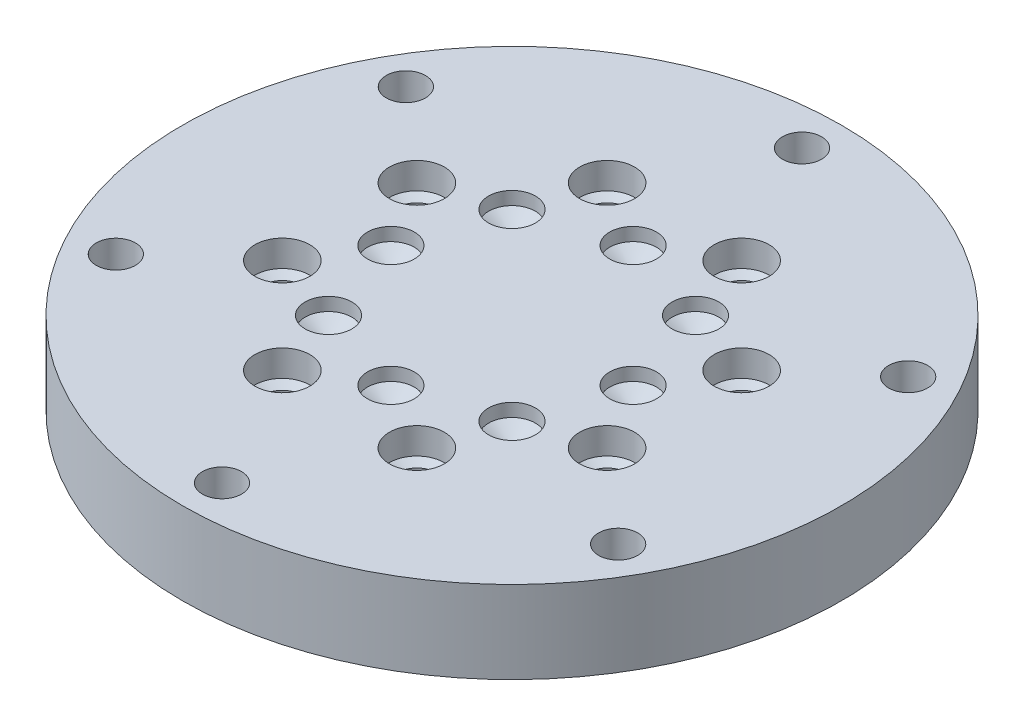
from build123d import *

# Parameters (mm, degrees)
OUTER_R                               = 19.05
BODY_DEPTH                            = 4.7625
F_4_40_TAPPED_HOLE_D                  = 2.2606
SCREW_HOLES_COUNT                     = 6
F_43_0_089_DIAMETER_HOLE1_D           = 2.2606
IO_HOLES_PATTERN_COUNT                = 8
F_36_0_1065_DIAMETER_HOLE1_AT_2_COUNT = 2
F_36_0_1065_DIAMETER_HOLE1_AT_2_PITCH = 5.568104507
POST_BOTTOMS_COUNT                    = 4


with BuildPart() as part:
    # outer → Body (new body)
    with BuildSketch(Plane(origin=(0, 0, 0), x_dir=(1, 0, 0), z_dir=(0, 1, 0))):
        Circle(OUTER_R)
    extrude(amount=-BODY_DEPTH)

    # #4-40 Tapped Hole (through all)
    with Locations(Plane(origin=(0, 0, 0), x_dir=(1, 0, 0), z_dir=(0, 1, 0))):
        with Locations((0, -16.764)):
            f_4_40_tapped_hole = Hole(F_4_40_TAPPED_HOLE_D / 2)

    # Screw Holes: #4-40 Tapped Hole ×6 about axis
    screw_holes_axis = Axis((0, 0.15875, 0), (0, -1, 0))
    for i in range(1, SCREW_HOLES_COUNT):
        add(f_4_40_tapped_hole.rotate(screw_holes_axis, i * 360 / SCREW_HOLES_COUNT), mode=Mode.SUBTRACT)

    # #43 (0.089) Diameter Hole1 (through all)
    with Locations(Plane(origin=(0, 0, 0), x_dir=(1, 0, 0), z_dir=(0, 1, 0))):
        with Locations((-3.888063673, 9.38661605)):
            f_43_0_089_diameter_hole1 = Hole(F_43_0_089_DIAMETER_HOLE1_D / 2)

    # Sketch40 → 1/8 (0.125) Diameter Hole1 (revolve, cut)
    with BuildSketch(Plane(origin=(-3.888063673, 0, -9.38661605), x_dir=(0, 0, 1), z_dir=(1, 0, 0))):
        Polygon((0, 0), (0, 2.477866233), (1.5875, 1.524), (1.5875, 0), align=None)
    f_1_8_0_125_diameter_hole1 = revolve(axis=Axis((-3.888063673, 6.35, -9.38661605), (0, -1, 0)), mode=Mode.SUBTRACT)

    # Sketch42 → 1/8 (0.125) Diameter Hole2 (revolve, cut)
    with BuildSketch(Plane(origin=(-3.888063673, -4.7625, -9.38661605), x_dir=(0, 0, -1), z_dir=(1, 0, 0))):
        Polygon((0, 0), (0, 2.477866233), (1.5875, 1.524), (1.5875, 0), align=None)
    f_1_8_0_125_diameter_hole2 = revolve(axis=Axis((-3.888063673, -11.1125, -9.38661605), (0, 1, 0)), mode=Mode.SUBTRACT)

    # IO Holes Pattern: #43 (0.089) Diameter Hole1, 1/8 (0.125) Diameter Hole1, 1/8 (0.125) Diameter Hole2 ×8 about axis
    io_holes_pattern_axis = Axis((0, 0.15875, 0), (0, -1, 0))
    add([f_43_0_089_diameter_hole1.rotate(io_holes_pattern_axis, i * 360 / IO_HOLES_PATTERN_COUNT) for i in range(1, IO_HOLES_PATTERN_COUNT)], mode=Mode.SUBTRACT)
    add([f_1_8_0_125_diameter_hole1.rotate(io_holes_pattern_axis, i * 360 / IO_HOLES_PATTERN_COUNT) for i in range(1, IO_HOLES_PATTERN_COUNT)], mode=Mode.SUBTRACT)
    add([f_1_8_0_125_diameter_hole2.rotate(io_holes_pattern_axis, i * 360 / IO_HOLES_PATTERN_COUNT) for i in range(1, IO_HOLES_PATTERN_COUNT)], mode=Mode.SUBTRACT)

    # Sketch45 → #36 (0.1065) Diameter Hole1 (revolve, cut)
    with BuildSketch(Plane(origin=(0, 0, -6.99999997), x_dir=(0, 0, 1), z_dir=(1, 0, 0))):
        Polygon((0, 0), (0, 1.57469403), (1.35255, 0.762), (1.35255, 0), align=None)
    f_36_0_1065_diameter_hole1 = revolve(axis=Axis((0, 6.35, -6.99999997), (0, -1, 0)), mode=Mode.SUBTRACT)

    # #36 (0.1065) Diameter Hole1 at 2: #36 (0.1065) Diameter Hole1 ×2
    with Locations(*[Vector(-0.9524427643588189, 0, 0.30471754235772414) * (i * F_36_0_1065_DIAMETER_HOLE1_AT_2_PITCH) for i in range(1, F_36_0_1065_DIAMETER_HOLE1_AT_2_COUNT)]):
        add(f_36_0_1065_diameter_hole1, mode=Mode.SUBTRACT)

    # Post Bottoms: #36 (0.1065) Diameter Hole1 ×4 about axis
    post_bottoms_axis = Axis((0, 0.15875, 0), (0, -1, 0))
    for i in range(1, POST_BOTTOMS_COUNT):
        add(f_36_0_1065_diameter_hole1.rotate(post_bottoms_axis, i * 360 / POST_BOTTOMS_COUNT), mode=Mode.SUBTRACT)

    # Post Bottoms copy 1 sketch → Post Bottoms copy 1 (revolve, cut)
    with BuildSketch(Plane(origin=(5.303300849, 0, -5.303300849), x_dir=(-1, 0, 0), z_dir=(0, 0, 1))):
        Polygon((0, 0), (0, 1.57469403), (1.35255, 0.762), (1.35255, 0), align=None)
    revolve(axis=Axis((5.303300849, 6.35, -5.303300849), (0, -1, 0)), mode=Mode.SUBTRACT)

    # Post Bottoms copy 2 sketch → Post Bottoms copy 2 (revolve, cut)
    with BuildSketch(Plane(origin=(5.303300849, 0, 5.303300849), x_dir=(0, 0, -1), z_dir=(-1, 0, 0))):
        Polygon((0, 0), (0, 1.57469403), (1.35255, 0.762), (1.35255, 0), align=None)
    revolve(axis=Axis((5.303300849, 6.35, 5.303300849), (0, -1, 0)), mode=Mode.SUBTRACT)

    # Post Bottoms copy 3 sketch → Post Bottoms copy 3 (revolve, cut)
    with BuildSketch(Plane(origin=(-5.303300849, 0, 5.303300849), x_dir=(1, 0, 0), z_dir=(0, 0, -1))):
        Polygon((0, 0), (0, 1.57469403), (1.35255, 0.762), (1.35255, 0), align=None)
    revolve(axis=Axis((-5.303300849, 6.35, 5.303300849), (0, -1, 0)), mode=Mode.SUBTRACT)


solid = part.part
